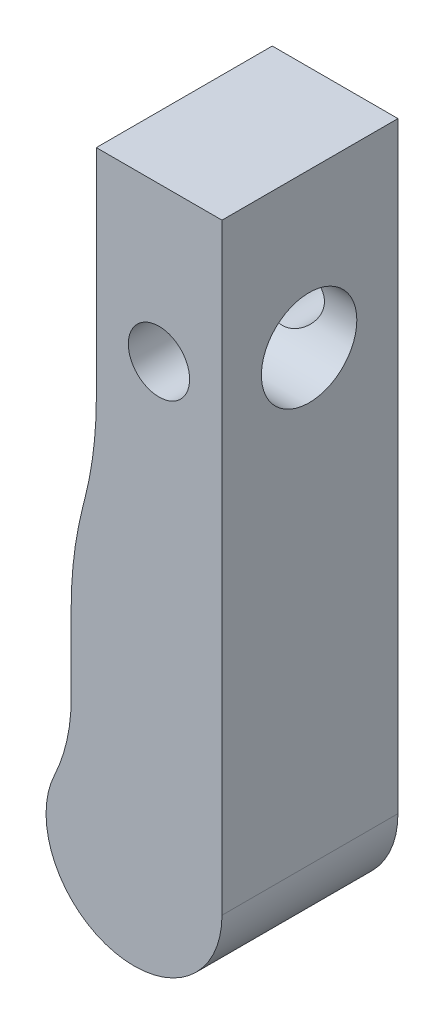
from build123d import *

# Parameters (mm, degrees)
BOSS_EXTRU_2_DEPTH = 7
CONG_1_R           = 7
CONG_2_R           = 15
D_GAGEMENT_21_D    = 2.4384
D_GAGEMENT_61_D    = 3.7973


with BuildPart() as part:
    # Esquisse1 → Boss.-Extru.2 (new body)
    with BuildSketch(Plane.XY):
        with BuildLine():
            Line((-5, 0), (-5, -10.5))
            Line((-5, -10.5), (-6, -14.5))
            Line((-6, -14.5), (-6, -21.5))
            ThreePointArc((-6, -21.5), (-4.822875656, -27.189860092), (0, -23.949489743))
            Line((0, -23.949489743), (0, 0))
            Line((0, 0), (-5, 0))
        make_face()
    extrude(amount=BOSS_EXTRU_2_DEPTH)

    # Congé1
    cong_1_edges = [part.edges().sort_by_distance(p)[0] for p in [
        (-6, -21.5, 3.5),
    ]]
    fillet(cong_1_edges, radius=CONG_1_R)

    # Congé2
    cong_2_edges = [part.edges().sort_by_distance(p)[0] for p in [
        (-6, -14.5, 3.5),
        (-5, -10.5, 3.5),
    ]]
    fillet(cong_2_edges, radius=CONG_2_R)

    # Dégagement #21 (through all)
    with Locations(Plane.XY.offset(7)):
        with Locations((-2.507622815, -6.12792642)):
            Hole(D_GAGEMENT_21_D / 2)

    # Dégagement #61 (through all)
    with Locations(Plane(origin=(0, 0, 0), x_dir=(0, 0, -1), z_dir=(1, 0, 0))):
        with Locations((-3.534219903, -6.12792642)):
            Hole(D_GAGEMENT_61_D / 2)


solid = part.part
